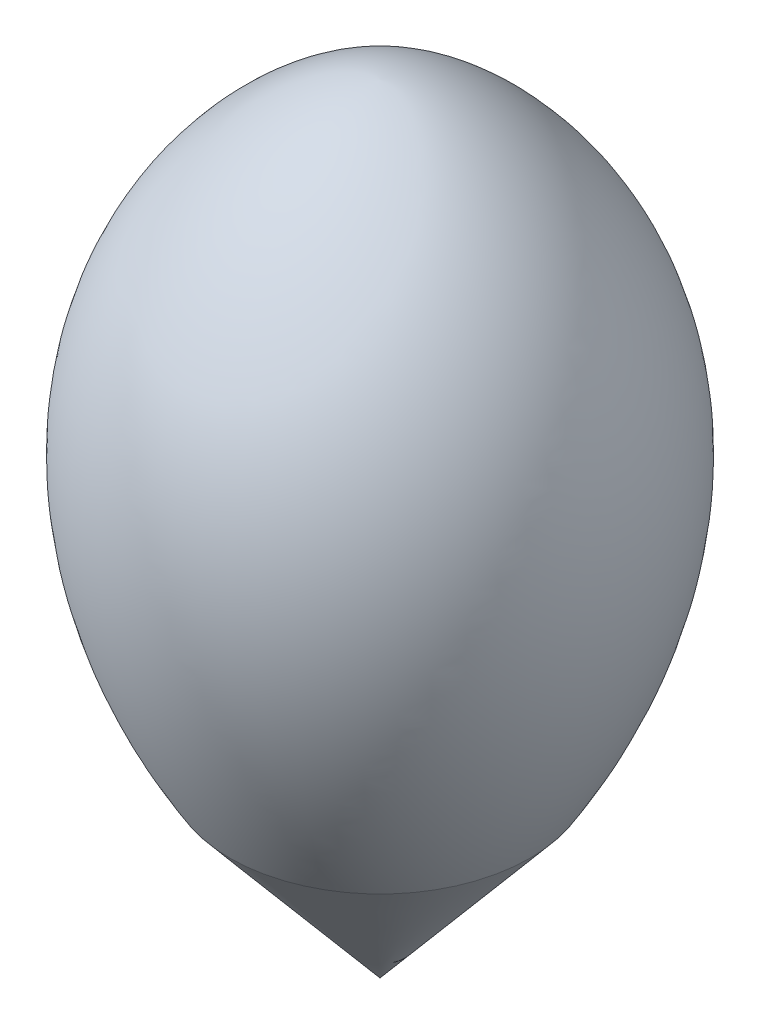
from build123d import *

# Parameters (mm, degrees)
SHELL1_T = 0.25


# Read off the part's stored shape, not the designer's step: Revolve1
with BuildPart() as part:
    # Revolve1 outline → Revolve1 (revolve)
    with BuildSketch(Plane.XY):
        with BuildLine():
            Line((0, 99.993410936), (0, 0))
            Line((0, 0), (19.279392922, 22.976285778))
            add(Edge.make_bspline(
                [(19.279392922, 22.976285778), (24.61131684, 31.523895726), (28.803327549, 40.862078497), (31.760542973, 50.896731386), (33.122680804, 61.660081015), (31.89066049, 73.361649155), (27.036472848, 85.836141268), (16.305897295, 92.475338884), (9.993410936, 99.4927835), (0, 99.993410936)],
                knots=[0.596124792, 0.596124792, 0.596124792, 0.596124792, 0.596124792, 0.596124792, 0.596124792, 0.596124792, 0.596124792, 0.596124792, 1.596124792, 1.596124792, 1.596124792, 1.596124792, 1.596124792, 1.596124792, 1.596124792, 1.596124792, 1.596124792, 1.596124792], degree=9))
        make_face()
    revolve(axis=Axis((0, 0, 0), (0, 1, 0)))

    # Shell1 (no face opened: a closed hollow body)
    add(offset(amount=-SHELL1_T, mode=Mode.PRIVATE), mode=Mode.SUBTRACT)


solid = part.part
